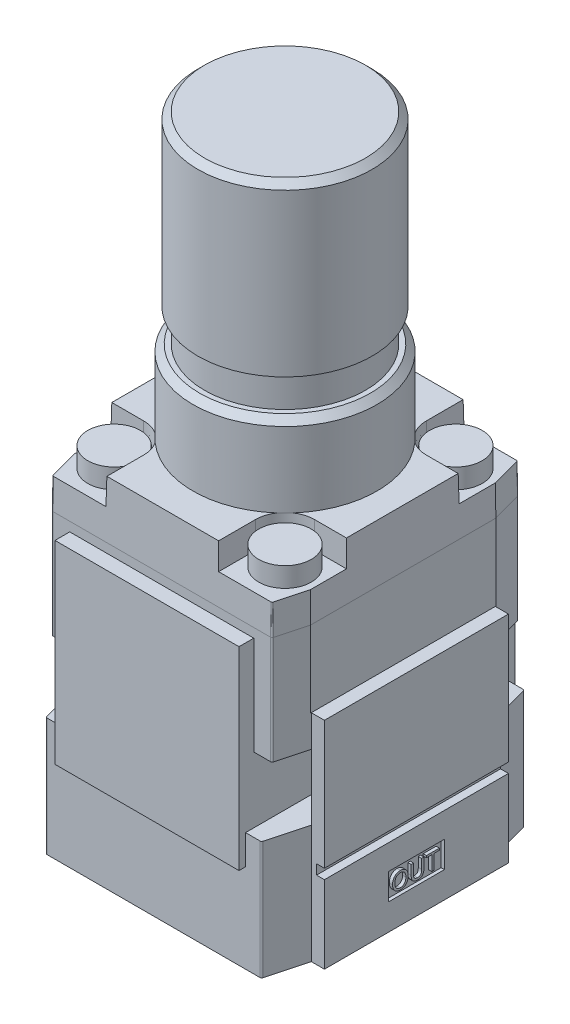
from build123d import *

# Parameters (mm, degrees)
BOTTOM_BASE_DEPTH                 = 23
BOTTOM_BASE_ROUNDS_R              = 0.25
TOP_BASE_DEPTH                    = 21.4
MGT_START                         = -5
MGT_GROOVES_DEPTH                 = 10
MGT_START_2                       = 9.8
MGT_GROOVES_2_DEPTH               = 11.6
MGT_START_3                       = -11.2
MGT_GROOVES_3_OUTLINE_W           = 1.2
MGT_GROOVES_3_OUTLINE_H           = 28
MGT_GROOVES_3_DEPTH               = 1.5
TOP_BASE_ROUNDS_R                 = 0.25
BONNET_THREADS_SKETCH_R           = 14
BONNET_THREADS_DEPTH              = 21
BONNET_THREADS_CHAM_SIZE          = 1
BONNET_KNOB_CHAM_SIZE             = 1
BONNET_BASE_DEPTH                 = 8.6
BONNET_BASE_TAPER                 = 1
BONNET_SCREW_CUTS_DEPTH           = 4
BONNET_SCREW_CUTS_DRAFT           = -1
BONNET_SCREW_CUTS_PROFILE_2_DEPTH = 4
BONNET_SCREW_CUTS_PROFILE_2_DRAFT = -1
BONNET_SCREWS_SKETCH_R            = 4
BONNET_SCREWS_DEPTH               = 3
BONNET_THREAD_LOC_DEPTH           = 2
GAUGE_BODY_SKETCH_W               = 28
GAUGE_BODY_SKETCH_H               = 29.5
GAUGE_BODY_DEPTH                  = 21
DIRECTION_IN_CUT_SKETCH_W         = 8.5
DIRECTION_IN_CUT_SKETCH_H         = 4
DIRECTION_IN_CUT_DEPTH            = 0.5
IN_SKETCH_W                       = 0.353457149
IN_SKETCH_H                       = 2.506332512
IN_2_DEPTH                        = 0.5
DIRECTION_OUT_CUT_SKETCH_W        = 8.5
DIRECTION_OUT_CUT_SKETCH_H        = 4
DIRECTION_OUT_CUT_DEPTH           = 0.5
OUT_DEPTH                         = 0.5


# Read off the part's stored shape, not the designer's step: MGT Grooves
with BuildPart() as part:
    # Bottom Base_Sketch → Bottom Base (new body)
    with BuildSketch(Plane(origin=(0, 0, 0), x_dir=(1, 0, 0), z_dir=(0, 1, 0))):
        Polygon((16.4, 20), (-16.4, 20), (-18.007695155, 14), (-20, 14), (-20, -14), (-18.007695155, -14), (-16.4, -20), (16.4, -20), (18.007695155, -14), (20, -14), (20, 14), (18.007695155, 14), align=None)
    extrude(amount=-BOTTOM_BASE_DEPTH)

    # Bottom Base Rounds
    bottom_base_rounds_edges = [part.edges().sort_by_distance(p)[0] for p in [
        (-16.4, -11.5, -20),
        (16.4, -11.5, -20),
        (16.4, -11.5, 20),
        (-16.4, -11.5, 20),
    ]]
    fillet(bottom_base_rounds_edges, radius=BOTTOM_BASE_ROUNDS_R)

    # Top Base_Sketch → Top Base (add)
    with BuildSketch(Plane(origin=(0, 0, 0), x_dir=(-1, 0, 0), z_dir=(0, 1, 0))):
        Polygon((18.022758664, -14), (20, -14), (20, 14), (18.022758664, 14), (16.75, 18.75), (-16.75, 18.75), (-18.022758664, 14), (-20, 14), (-20, -14), (-18.022758664, -14), (-16.75, -18.75), (16.75, -18.75), align=None)
    extrude(amount=TOP_BASE_DEPTH)

    # MGT Grooves outline → MGT Grooves (cut)
    with BuildSketch(Plane(origin=(0, 0, 0), x_dir=(1, 0, 0), z_dir=(0, 1, 0)).offset(MGT_START)):
        with BuildLine():
            Line((-15.690598923, 10), (15.690598923, 10))
            Line((15.690598923, 10), (18, 14))
            Line((18, 14), (18.022758664, 14))
            Line((18.022758664, 14), (16.75, 18.75))
            Line((16.75, 18.75), (16.734936491, 18.75))
            Line((16.734936491, 18.75), (16.44964971, 19.814704761))
            ThreePointArc((16.44964971, 19.814704761), (16.36035861, 19.948338335), (16.208168253, 20))
            Line((16.208168253, 20), (-16.208168253, 20))
            ThreePointArc((-16.208168253, 20), (-16.36035861, 19.948338335), (-16.44964971, 19.814704761))
            Line((-16.44964971, 19.814704761), (-16.734936491, 18.75))
            Line((-16.734936491, 18.75), (-16.75, 18.75))
            Line((-16.75, 18.75), (-18.022758664, 14))
            Line((-18.022758664, 14), (-18, 14))
            Line((-18, 14), (-15.690598923, 10))
        make_face()
        with BuildLine():
            Line((-15.690598923, -10), (-18, -14))
            Line((-18, -14), (-18.022758664, -14))
            Line((-18.022758664, -14), (-16.75, -18.75))
            Line((-16.75, -18.75), (-16.734936491, -18.75))
            Line((-16.734936491, -18.75), (-16.44964971, -19.814704761))
            ThreePointArc((-16.44964971, -19.814704761), (-16.36035861, -19.948338335), (-16.208168253, -20))
            Line((-16.208168253, -20), (16.208168253, -20))
            ThreePointArc((16.208168253, -20), (16.36035861, -19.948338335), (16.44964971, -19.814704761))
            Line((16.44964971, -19.814704761), (16.734936491, -18.75))
            Line((16.734936491, -18.75), (16.75, -18.75))
            Line((16.75, -18.75), (18.022758664, -14))
            Line((18.022758664, -14), (18, -14))
            Line((18, -14), (15.690598923, -10))
            Line((15.690598923, -10), (-15.690598923, -10))
        make_face()
    extrude(amount=MGT_GROOVES_DEPTH, mode=Mode.SUBTRACT)

    # MGT Grooves 2 outline → MGT Grooves 2 (cut)
    with BuildSketch(Plane(origin=(0, 0, 0), x_dir=(1, 0, 0), z_dir=(0, 1, 0)).offset(MGT_START_2)):
        Polygon((18.022758664, 14), (18, 14.084936491), (18, -14.084936491), (18.022758664, -14), (20, -14), (20, 14), align=None)
        Polygon((-18, 14.084936491), (-18.022758664, 14), (-20, 14), (-20, -14), (-18.022758664, -14), (-18, -14.084936491), align=None)
    extrude(amount=MGT_GROOVES_2_DEPTH, mode=Mode.SUBTRACT)

    # MGT Grooves 3 outline → MGT Grooves 3 (cut)
    with BuildSketch(Plane(origin=(0, 0, 0), x_dir=(1, 0, 0), z_dir=(0, 1, 0)).offset(MGT_START_3)):
        with Locations((19.4, 0)):
            Rectangle(MGT_GROOVES_3_OUTLINE_W, MGT_GROOVES_3_OUTLINE_H)
        with Locations((-19.4, 0)):
            Rectangle(MGT_GROOVES_3_OUTLINE_W, MGT_GROOVES_3_OUTLINE_H)
    extrude(amount=MGT_GROOVES_3_DEPTH, mode=Mode.SUBTRACT)

    # Top Base Rounds
    top_base_rounds_edges = [part.edges().sort_by_distance(p)[0] for p in [
        (-16.75, 13.2, 18.75),
        (16.75, 13.2, 18.75),
        (16.75, 13.2, -18.75),
        (-16.75, 13.2, -18.75),
    ]]
    fillet(top_base_rounds_edges, radius=TOP_BASE_ROUNDS_R)

    # Bonnet Threads_Sketch → Bonnet Threads (add)
    with BuildSketch(Plane(origin=(0, 21.4, 0), x_dir=(-1, 0, 0), z_dir=(0, 1, 0))):
        with Locations(Location((0, 0, 0), (0, 0, 270))):
            Circle(BONNET_THREADS_SKETCH_R)
    extrude(amount=BONNET_THREADS_DEPTH)

    # Bonnet Threads Cham
    bonnet_threads_cham_edges = [part.edges().sort_by_distance(p)[0] for p in [
        (0, 42.4, 14),
    ]]
    chamfer(bonnet_threads_cham_edges, length=BONNET_THREADS_CHAM_SIZE)

    # Bonnet Knob_Sketch → Bonnet Knob (revolve)
    with BuildSketch(Plane.XY, mode=Mode.PRIVATE) as bonnet_knob_sk:
        Polygon((0, 73), (-13.25, 73), (-13.25, 47.4), (-12.25, 47.4), (-12.25, 42.4), (0, 42.4), align=None)
    revolve(bonnet_knob_sk.sketch.rotate(Axis((0, 0, 0), (0, 1, 0)), 270), axis=Axis((0, 0, 0), (0, 1, 0)))

    # Bonnet Knob Cham
    bonnet_knob_cham_edges = [part.edges().sort_by_distance(p)[0] for p in [
        (0, 73, 13.25),
    ]]
    chamfer(bonnet_knob_cham_edges, length=BONNET_KNOB_CHAM_SIZE)

    # Bonnet Base_Sketch → Bonnet Base (add)
    with BuildSketch(Plane(origin=(0, 21.4, 0), x_dir=(-1, 0, 0), z_dir=(0, 1, 0))):
        with BuildLine():
            Line((18, -14.084936491), (18, 14.084936491))
            Line((18, 14.084936491), (16.79964971, 18.564704761))
            ThreePointArc((16.79964971, 18.564704761), (16.71035861, 18.698338335), (16.558168253, 18.75))
            Line((16.558168253, 18.75), (-16.558168253, 18.75))
            ThreePointArc((-16.558168253, 18.75), (-16.71035861, 18.698338335), (-16.79964971, 18.564704761))
            Line((-16.79964971, 18.564704761), (-18, 14.084936491))
            Line((-18, 14.084936491), (-18, -14.084936491))
            Line((-18, -14.084936491), (-16.79964971, -18.564704761))
            ThreePointArc((-16.79964971, -18.564704761), (-16.71035861, -18.698338335), (-16.558168253, -18.75))
            Line((-16.558168253, -18.75), (16.558168253, -18.75))
            ThreePointArc((16.558168253, -18.75), (16.71035861, -18.698338335), (16.79964971, -18.564704761))
            Line((16.79964971, -18.564704761), (18, -14.084936491))
        make_face()
    extrude(amount=BONNET_BASE_DEPTH, taper=BONNET_BASE_TAPER)


with BuildPart() as bonnet_screw_cuts_tool:
    # Bonnet Screw Cuts_Sketch → Bonnet Screw Cuts (with draft: the straight prism first)
    with BuildSketch(Plane(origin=(0, 30, 0), x_dir=(-1, 0, 0), z_dir=(0, 1, 0))):
        with BuildLine():
            Line((8.5, -20), (20, -20))
            Line((20, -20), (20, 20))
            Line((20, 20), (8.5, 20))
            Line((8.5, 20), (8.5, 13))
            ThreePointArc((8.5, 13), (9.818019485, 9.818019485), (13, 8.5))
            Line((13, 8.5), (18, 8.5))
            Line((18, 8.5), (18, -8.5))
            Line((18, -8.5), (13, -8.5))
            ThreePointArc((13, -8.5), (9.818019485, -9.818019485), (8.5, -13))
            Line((8.5, -13), (8.5, -20))
        make_face()
    extrude(amount=-BONNET_SCREW_CUTS_DEPTH)
    # Bonnet Screw Cuts: the draft: its side faces are tilted about the plane it starts from
    bonnet_screw_cuts_sides = [bonnet_screw_cuts_tool.faces().sort_by_distance(p)[0] for p in [
        (-8.5, 28, -16.5),
        (-14.25, 28, -20),
        (-20, 28, 0),
        (-14.25, 28, 20),
        (-8.5, 28, 16.5),
        (-9.818019485, 28, 9.818019485),
        (-15.5, 28, 8.5),
        (-18, 28, 0),
        (-15.5, 28, -8.5),
        (-9.818019485, 28, -9.818019485),
    ]]
    draft(bonnet_screw_cuts_sides, Plane(origin=(0, 30, 0), x_dir=(-1, 0, 0), z_dir=(0, 1, 0)), BONNET_SCREW_CUTS_DRAFT)


with BuildPart() as part_1:
    add(part.part)

    # Bonnet Screw Cuts: cut by bonnet_screw_cuts_tool
    add(bonnet_screw_cuts_tool.part, mode=Mode.SUBTRACT)


with BuildPart() as bonnet_screw_cuts_profile_2_tool:
    # Bonnet Screw Cuts_Sketch → Bonnet Screw Cuts profile 2 (with draft: the straight prism first)
    with BuildSketch(Plane(origin=(0, 30, 0), x_dir=(-1, 0, 0), z_dir=(0, 1, 0))):
        with BuildLine():
            Line((-8.5, 20), (-20, 20))
            Line((-20, 20), (-20, -20))
            Line((-20, -20), (-8.5, -20))
            Line((-8.5, -20), (-8.5, -13))
            ThreePointArc((-8.5, -13), (-9.818019485, -9.818019485), (-13, -8.5))
            Line((-13, -8.5), (-18, -8.5))
            Line((-18, -8.5), (-18, 8.5))
            Line((-18, 8.5), (-13, 8.5))
            ThreePointArc((-13, 8.5), (-9.818019485, 9.818019485), (-8.5, 13))
            Line((-8.5, 13), (-8.5, 20))
        make_face()
    extrude(amount=-BONNET_SCREW_CUTS_PROFILE_2_DEPTH)
    # Bonnet Screw Cuts profile 2: the draft: its side faces are tilted about the plane it starts from
    bonnet_screw_cuts_profile_2_sides = [bonnet_screw_cuts_profile_2_tool.faces().sort_by_distance(p)[0] for p in [
        (8.5, 28, 16.5),
        (14.25, 28, 20),
        (20, 28, 0),
        (14.25, 28, -20),
        (8.5, 28, -16.5),
        (9.818019485, 28, -9.818019485),
        (15.5, 28, -8.5),
        (18, 28, 0),
        (15.5, 28, 8.5),
        (9.818019485, 28, 9.818019485),
    ]]
    draft(bonnet_screw_cuts_profile_2_sides, Plane(origin=(0, 30, 0), x_dir=(-1, 0, 0), z_dir=(0, 1, 0)), BONNET_SCREW_CUTS_PROFILE_2_DRAFT)


with BuildPart() as part_2:
    add(part_1.part)

    # Bonnet Screw Cuts profile 2: cut by bonnet_screw_cuts_profile_2_tool
    add(bonnet_screw_cuts_profile_2_tool.part, mode=Mode.SUBTRACT)

    # Bonnet Screws_Sketch → Bonnet Screws (add)
    with BuildSketch(Plane(origin=(0, 26, 0), x_dir=(-1, 0, 0), z_dir=(0, 1, 0))):
        with Locations(Location((13, -13, 0), (0, 0, 270))):
            Circle(BONNET_SCREWS_SKETCH_R)
        with Locations(Location((13, 13, 0), (0, 0, 270))):
            Circle(BONNET_SCREWS_SKETCH_R)
        with Locations(Location((-13, 13, 0), (0, 0, 90))):
            Circle(BONNET_SCREWS_SKETCH_R)
        with Locations(Location((-13, -13, 0), (0, 0, 270))):
            Circle(BONNET_SCREWS_SKETCH_R)
    extrude(amount=BONNET_SCREWS_DEPTH)

    # Bonnet Thread Loc_Sketch → Bonnet Thread Loc (add)
    with BuildSketch(Plane(origin=(0, 30, 0), x_dir=(-1, 0, 0), z_dir=(0, 1, 0))):
        with BuildLine():
            Line((0, 2.5), (0, -2.5))
            Line((0, -2.5), (14, -2.5))
            ThreePointArc((14, -2.5), (16.5, 0), (14, 2.5))
            Line((14, 2.5), (0, 2.5))
        make_face()
    extrude(amount=BONNET_THREAD_LOC_DEPTH)

    # Gauge Body_Sketch → Gauge Body (add, symmetric)
    with BuildSketch(Plane.XY):
        with Locations((0, 5.25)):
            Rectangle(GAUGE_BODY_SKETCH_W, GAUGE_BODY_SKETCH_H)
    extrude(amount=GAUGE_BODY_DEPTH, both=True)

    # Direction In Cut_Sketch → Direction In Cut (cut)
    with BuildSketch(Plane.ZY.offset(20)):
        with Locations((0, -17)):
            Rectangle(DIRECTION_IN_CUT_SKETCH_W, DIRECTION_IN_CUT_SKETCH_H)
    extrude(amount=-DIRECTION_IN_CUT_DEPTH, mode=Mode.SUBTRACT)

    # IN_Sketch → IN 2 (add)
    with BuildSketch(Plane.ZY.offset(19.5)):
        with Locations((-1.251946745, -17.096833744)):
            Rectangle(IN_SKETCH_W, IN_SKETCH_H)
        Polygon((-0.496833744, -18.35), (-0.496833744, -15.843667488), (-0.123293803, -15.843667488), (1.077657193, -17.713877546), (1.077657193, -15.843667488), (1.431114342, -15.843667488), (1.431114342, -18.35), (1.0575744, -18.35), (-0.143376595, -16.479789943), (-0.143376595, -18.35), align=None)
    extrude(amount=IN_2_DEPTH)

    # Direction OUT Cut_Sketch → Direction OUT Cut (cut)
    with BuildSketch(Plane(origin=(20, 0, 0), x_dir=(0, 0, -1), z_dir=(1, 0, 0))):
        with Locations((0, -17)):
            Rectangle(DIRECTION_OUT_CUT_SKETCH_W, DIRECTION_OUT_CUT_SKETCH_H)
    extrude(amount=-DIRECTION_OUT_CUT_DEPTH, mode=Mode.SUBTRACT)

    # OUT_Sketch → OUT (add)
    # profile 1 of 3: a face of its own
    with BuildSketch(Plane(origin=(19.5, 0, 0), x_dir=(0, 0, -1), z_dir=(1, 0, 0))):
        with BuildLine():
            add(Edge.make_bspline(
                [(-3.638749337, -17.075502782), (-3.637875043, -17.025068967), (-3.636171524, -16.926801238), (-3.620254631, -16.783710763), (-3.594409682, -16.649081343), (-3.557462041, -16.522923466), (-3.5106308, -16.405039444), (-3.453698479, -16.295162345), (-3.384952594, -16.194535898), (-3.307183479, -16.102202207), (-3.22031895, -16.020572456), (-3.127832916, -15.948073541), (-3.028570516, -15.887600876), (-2.923448859, -15.83767039), (-2.812021329, -15.799335209), (-2.694600779, -15.772497094), (-2.57131279, -15.755183902), (-2.487042564, -15.753235245), (-2.44398271, -15.752239532)],
                knots=[0, 0, 0, 0, 1.203621547, 2.345195544, 3.432004029, 4.472479546, 5.478447225, 6.455936844, 7.420185704, 8.381829745, 9.332027588, 10.260832629, 11.182364398, 12.100723901, 13.034044877, 13.989196293, 14.972532542, 16, 16, 16, 16], degree=3))
            add(Edge.make_bspline(
                [(-2.44398271, -15.752239532), (-2.415581777, -15.752735466), (-2.359182662, -15.753720301), (-2.275801603, -15.761213578), (-2.194563144, -15.774587779), (-2.115547284, -15.792510709), (-2.038538943, -15.816024814), (-1.963492131, -15.843782498), (-1.8910638, -15.878178178), (-1.820772104, -15.916687565), (-1.753446784, -15.959761979), (-1.690174616, -16.007346196), (-1.631107158, -16.05908034), (-1.575450974, -16.114114042), (-1.525063232, -16.174304613), (-1.477862286, -16.237818545), (-1.435204483, -16.305782042), (-1.396938464, -16.377638259), (-1.362724755, -16.45227739), (-1.333482533, -16.530008784), (-1.308372771, -16.609899997), (-1.287353782, -16.692423902), (-1.27227209, -16.777552285), (-1.260262376, -16.864918336), (-1.253941332, -16.954807598), (-1.252811584, -17.015529397), (-1.252239532, -17.046276099)],
                knots=[0, 0, 0, 0, 1.034375294, 2.054082248, 3.045783978, 4.031219655, 5.002789406, 5.976610191, 6.94273282, 7.920236376, 8.894345378, 9.851183672, 10.800797181, 11.752517031, 12.698794154, 13.65688337, 14.632873302, 15.61821402, 16.620222298, 17.621258913, 18.640965868, 19.669244166, 20.720417492, 21.788124603, 22.880008887, 24, 24, 24, 24], degree=3))
            add(Edge.make_bspline(
                [(-1.252239532, -17.046276099), (-1.252763656, -17.077529815), (-1.253799153, -17.13927692), (-1.260805752, -17.230496287), (-1.273125786, -17.319096935), (-1.289466215, -17.405343055), (-1.31136189, -17.4890551), (-1.337381536, -17.57047308), (-1.368853767, -17.64911205), (-1.404398158, -17.725161549), (-1.444616621, -17.797575631), (-1.488980316, -17.865847943), (-1.537520669, -17.929339851), (-1.58950036, -17.988830239), (-1.646133252, -18.043255308), (-1.706721987, -18.093123971), (-1.771033603, -18.138906548), (-1.839284155, -18.179363102), (-1.910248792, -18.214824717), (-1.982523236, -18.246285559), (-2.056161175, -18.273116616), (-2.131414281, -18.294860522), (-2.208077269, -18.311291781), (-2.285934403, -18.323595682), (-2.365240908, -18.33068031), (-2.418605794, -18.33172417), (-2.445494435, -18.332250133)],
                knots=[0, 0, 0, 0, 1.141429366, 2.255090526, 3.338676798, 4.407031443, 5.458968682, 6.496860253, 7.526652771, 8.550250826, 9.560787671, 10.54935636, 11.521089193, 12.477323897, 13.431786008, 14.386110112, 15.340986122, 16.312041, 17.28047646, 18.236612773, 19.189437236, 20.140779471, 21.09494583, 22.051062463, 23.018000708, 24, 24, 24, 24], degree=3))
            add(Edge.make_bspline(
                [(-2.445494435, -18.332250133), (-2.474405696, -18.331822387), (-2.531671662, -18.33097513), (-2.616312304, -18.32251806), (-2.698847219, -18.309616505), (-2.779036464, -18.290990558), (-2.856770464, -18.266691694), (-2.932141196, -18.237281118), (-3.005413747, -18.203151893), (-3.075678925, -18.163326787), (-3.142697577, -18.119045551), (-3.205820133, -18.070528303), (-3.26501169, -18.018222175), (-3.319322465, -17.961262607), (-3.370511413, -17.901714406), (-3.416531769, -17.837364202), (-3.458886488, -17.769671392), (-3.496322223, -17.697983444), (-3.530139807, -17.624430654), (-3.558631853, -17.548989494), (-3.583670838, -17.472771766), (-3.603611856, -17.395307695), (-3.61950242, -17.316775974), (-3.630187673, -17.237307277), (-3.637904644, -17.156783249), (-3.638466356, -17.102732614), (-3.638749337, -17.075502782)],
                knots=[0, 0, 0, 0, 1.072727997, 2.12480551, 3.153819198, 4.171534612, 5.177148798, 6.173931848, 7.17235114, 8.174500385, 9.168706755, 10.151274001, 11.127173509, 12.097141049, 13.070188938, 14.039134204, 15.03036519, 16.031505612, 17.038625933, 18.033164522, 19.022845559, 20.014762458, 21.000193215, 21.994692725, 22.989758729, 24, 24, 24, 24], degree=3))
        make_face()
        with BuildLine():
            add(Edge.make_bspline(
                [(-3.28399788, -17.079534048), (-3.28345424, -17.115850945), (-3.282394181, -17.18666633), (-3.270266529, -17.289911396), (-3.251864755, -17.387328374), (-3.226499852, -17.479190736), (-3.192403211, -17.564589977), (-3.151636261, -17.644346701), (-3.102826371, -17.717930731), (-3.047050431, -17.785136224), (-2.985703292, -17.845508602), (-2.920147647, -17.898240663), (-2.850368761, -17.942400034), (-2.777140257, -17.978863022), (-2.699936168, -18.007325709), (-2.618987722, -18.027311491), (-2.534235442, -18.039810975), (-2.476444839, -18.041260532), (-2.44700616, -18.04199894)],
                knots=[0, 0, 0, 0, 1.215430442, 2.370003584, 3.475209778, 4.53279855, 5.55522989, 6.548792651, 7.526809858, 8.505409025, 9.467826767, 10.404123909, 11.316848639, 12.227335424, 13.138360512, 14.065900994, 15.014765094, 16, 16, 16, 16], degree=3))
            add(Edge.make_bspline(
                [(-2.44700616, -18.04199894), (-2.417068494, -18.04124961), (-2.358450629, -18.039782425), (-2.272420593, -18.027501142), (-2.190682429, -18.006592782), (-2.112425964, -17.978759019), (-2.039066001, -17.941132515), (-1.968886859, -17.897072085), (-1.903801631, -17.843231502), (-1.842212659, -17.782752348), (-1.786971499, -17.714006683), (-1.737956599, -17.63868793), (-1.698140345, -17.5556665), (-1.663764383, -17.466771241), (-1.638592323, -17.370321999), (-1.619988627, -17.267415208), (-1.608777647, -17.157719849), (-1.607597073, -17.08241602), (-1.60699099, -17.043756557)],
                knots=[0, 0, 0, 0, 0.976878588, 1.912725521, 2.8289017, 3.727303729, 4.617335839, 5.514666588, 6.426584173, 7.368641557, 8.327632997, 9.299405846, 10.294892156, 11.327373912, 12.405931897, 13.542618837, 14.738430195, 16, 16, 16, 16], degree=3))
            add(Edge.make_bspline(
                [(-1.60699099, -17.043756557), (-1.607205179, -17.018885575), (-1.607625341, -16.970097709), (-1.613189697, -16.898183835), (-1.620367001, -16.828506895), (-1.631294559, -16.761156796), (-1.64635412, -16.69641245), (-1.663037557, -16.633780958), (-1.68389961, -16.573802043), (-1.707570518, -16.516240491), (-1.734057862, -16.461391812), (-1.763932064, -16.409718402), (-1.796845923, -16.361421156), (-1.831911387, -16.315584407), (-1.87107018, -16.273982225), (-1.912436786, -16.234857315), (-1.956950843, -16.199018005), (-2.004168119, -16.166454934), (-2.053418775, -16.137143038), (-2.104601282, -16.112055859), (-2.156900229, -16.090019923), (-2.211191026, -16.073128454), (-2.266724022, -16.059505236), (-2.323723712, -16.049157133), (-2.382401663, -16.043798404), (-2.421969356, -16.042929748), (-2.441967077, -16.042490725)],
                knots=[0, 0, 0, 0, 1.220438779, 2.394059227, 3.538503547, 4.658058814, 5.74010225, 6.800155734, 7.837851593, 8.854470756, 9.853724944, 10.825214244, 11.781044712, 12.72106398, 13.654479919, 14.581868691, 15.514082315, 16.456304431, 17.39516604, 18.324312202, 19.252140633, 20.177768678, 21.111585046, 22.057694709, 23.018348693, 24, 24, 24, 24], degree=3))
            add(Edge.make_bspline(
                [(-2.441967077, -16.042490725), (-2.470231126, -16.043052038), (-2.525999246, -16.044159571), (-2.608096557, -16.056471518), (-2.687247267, -16.074867249), (-2.763574208, -16.100585462), (-2.836424568, -16.134640418), (-2.906175778, -16.17640416), (-2.973446983, -16.224739528), (-3.037177412, -16.280824203), (-3.096588112, -16.345251804), (-3.146813898, -16.421209971), (-3.189145563, -16.506885423), (-3.224491723, -16.602060993), (-3.251442129, -16.707473753), (-3.270068231, -16.822670062), (-3.281828372, -16.947771309), (-3.283256223, -17.034490296), (-3.28399788, -17.079534048)],
                knots=[0, 0, 0, 0, 0.895090134, 1.766112571, 2.624765742, 3.468151641, 4.313618154, 5.168136083, 6.041303099, 6.935189387, 7.854749729, 8.809996334, 9.809869957, 10.877771942, 12.021723904, 13.25217762, 14.572720513, 16, 16, 16, 16], degree=3))
        make_face(mode=Mode.SUBTRACT)
    # profile 2 of 3: a face of its own
    with BuildSketch(Plane(origin=(19.5, 0, 0), x_dir=(0, 0, -1), z_dir=(1, 0, 0))):
        with BuildLine():
            Line((0.779518815, -15.784489665), (1.134270273, -15.784489665))
            Line((1.134270273, -15.784489665), (1.134270273, -17.231714361))
            add(Edge.make_bspline(
                [(1.134270273, -17.231714361), (1.133902128, -17.26245536), (1.133185716, -17.322277396), (1.129889915, -17.409521047), (1.123469546, -17.491916998), (1.113640103, -17.569331995), (1.102527884, -17.642101805), (1.087728132, -17.709828601), (1.07075403, -17.772785727), (1.051223747, -17.831398533), (1.027584154, -17.886062993), (1.000575849, -17.937949682), (0.969079808, -17.987210091), (0.933177718, -18.033769455), (0.892679088, -18.077373277), (0.848689778, -18.119139303), (0.80004857, -18.157919366), (0.747290551, -18.194157385), (0.690350206, -18.227046253), (0.628978261, -18.25542156), (0.563249585, -18.278816335), (0.493460974, -18.298719073), (0.419264026, -18.313474817), (0.34089677, -18.324667329), (0.258255452, -18.331250612), (0.201715726, -18.331912025), (0.172813198, -18.332250133)],
                knots=[0, 0, 0, 0, 1.311435591, 2.552055809, 3.723716842, 4.835547674, 5.880436826, 6.862821995, 7.791032428, 8.661143393, 9.495683908, 10.328993084, 11.1538804, 11.986573222, 12.833449924, 13.690091648, 14.571895854, 15.484149563, 16.418232274, 17.373591634, 18.364096258, 19.391643703, 20.466661433, 21.588422397, 22.767226238, 24, 24, 24, 24], degree=3))
            add(Edge.make_bspline(
                [(0.172813198, -18.332250133), (0.144586353, -18.331834635), (0.089588548, -18.331025069), (0.008994099, -18.32555079), (-0.06766893, -18.315849769), (-0.140631909, -18.303118588), (-0.209649926, -18.285864473), (-0.274620515, -18.264745283), (-0.335765493, -18.24004115), (-0.393092172, -18.211933695), (-0.445930392, -18.179482141), (-0.495214273, -18.144060006), (-0.540723457, -18.105281587), (-0.582035181, -18.06279736), (-0.619639241, -18.017247076), (-0.653011539, -17.968143924), (-0.682231988, -17.915400328), (-0.708035352, -17.859155173), (-0.730517128, -17.798580535), (-0.74864554, -17.732850879), (-0.765046319, -17.662134917), (-0.777634251, -17.586175731), (-0.788691394, -17.505068703), (-0.795103502, -17.418574131), (-0.799988888, -17.326840826), (-0.800483761, -17.263972002), (-0.800737677, -17.231714361)],
                knots=[0, 0, 0, 0, 1.192889473, 2.324252067, 3.41162405, 4.457325556, 5.452435892, 6.415456921, 7.342133401, 8.237363544, 9.110250727, 9.959377435, 10.800155199, 11.633438097, 12.46053001, 13.293359256, 14.138649731, 15.005774073, 15.906391469, 16.865847877, 17.8852706, 18.972920589, 20.118424796, 21.343408205, 22.636917643, 24, 24, 24, 24], degree=3))
            Line((-0.800737677, -17.231714361), (-0.800737677, -15.784489665))
            Line((-0.800737677, -15.784489665), (-0.44598622, -15.784489665))
            Line((-0.44598622, -15.784489665), (-0.44598622, -17.215085386))
            add(Edge.make_bspline(
                [(-0.44598622, -17.215085386), (-0.445754421, -17.241121917), (-0.445307161, -17.291359786), (-0.442973648, -17.364134983), (-0.438307029, -17.431669926), (-0.432537852, -17.494067715), (-0.424606302, -17.55110302), (-0.414449098, -17.602692311), (-0.403056093, -17.649011275), (-0.385995218, -17.703179082), (-0.357675779, -17.763646039), (-0.313046368, -17.827736068), (-0.258589611, -17.883414796), (-0.193784459, -17.929396641), (-0.120190928, -17.965932637), (-0.038305121, -17.991124658), (0.050901495, -18.007325599), (0.112940643, -18.008921554), (0.14509824, -18.009748807)],
                knots=[0, 0, 0, 0, 1.090245215, 2.103644224, 3.048223674, 3.924421557, 4.727106666, 5.45815927, 6.12513286, 6.723455763, 7.834131158, 8.905266051, 9.9795367, 11.078391299, 12.21701853, 13.404826756, 14.65480846, 16, 16, 16, 16], degree=3))
            add(Edge.make_bspline(
                [(0.14509824, -18.009748807), (0.172659638, -18.009279602), (0.225877907, -18.008373615), (0.302617139, -18.001067138), (0.372968659, -17.987747277), (0.437516348, -17.970582321), (0.495805973, -17.947271417), (0.548193931, -17.919028936), (0.594496403, -17.88570289), (0.635045642, -17.846390419), (0.669984152, -17.799345659), (0.699430977, -17.743279717), (0.724516136, -17.678143734), (0.745073101, -17.603722679), (0.760062009, -17.519663091), (0.771779325, -17.426506365), (0.777923309, -17.32384295), (0.77897167, -17.252381513), (0.779518815, -17.215085386)],
                knots=[0, 0, 0, 0, 1.111629428, 2.146443922, 3.104513091, 3.997025448, 4.836178689, 5.630482806, 6.392099463, 7.129930272, 7.899580577, 8.745272349, 9.676297551, 10.710246713, 11.854352966, 13.117392195, 14.495550762, 16, 16, 16, 16], degree=3))
            Line((0.779518815, -17.215085386), (0.779518815, -15.784489665))
        make_face()
    # profile 3 of 3: a face of its own
    with BuildSketch(Plane(origin=(19.5, 0, 0), x_dir=(0, 0, -1), z_dir=(1, 0, 0))):
        Polygon((2.327525176, -18.3), (2.327525176, -16.074740857), (1.521271863, -16.074740857), (1.521271863, -15.784489665), (3.488529946, -15.784489665), (3.488529946, -16.074740857), (2.682276633, -16.074740857), (2.682276633, -18.3), align=None)
    extrude(amount=OUT_DEPTH)


solid = part_2.part
